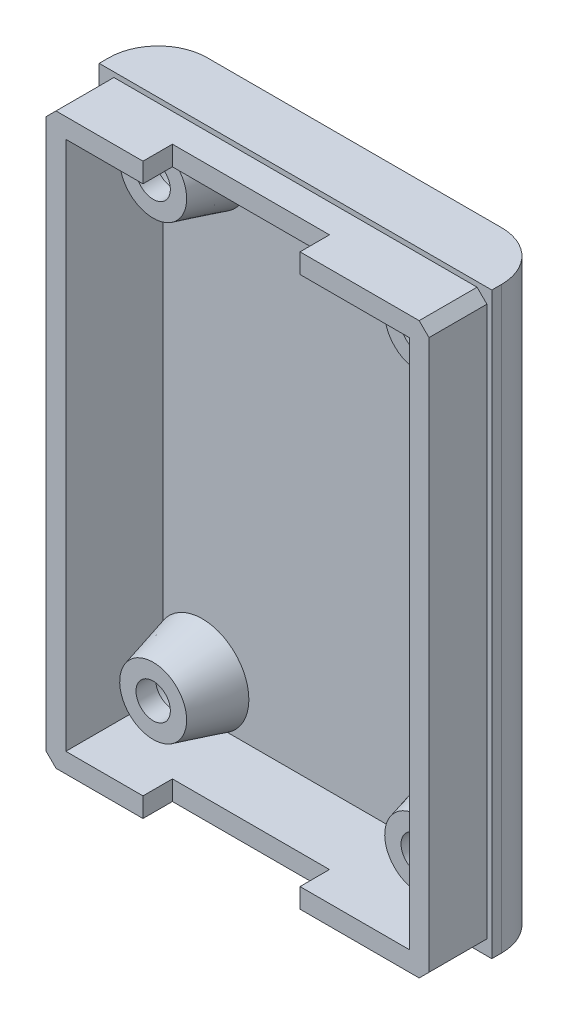
from build123d import *

# Parameters (mm, degrees)
BASE_W              = 40
BASE_H              = 59
EXTRUDE_1_DEPTH     = 2
SKETCH_2_W          = 40
SKETCH_2_H          = 59
SKETCH_2_W_2        = 35
SKETCH_2_H_2        = 54
EXTRUDE_2_DEPTH     = 10
SKETCH_3_R          = 3.25
EXTRUDE_3_DEPTH     = 5
SKETCH_4_R          = 2.9
CUT_EXTRUDE_2_DEPTH = 5
CHAMFER_1_SIZE      = 1.5
CHAMFER_1_SIZE_2    = 5.598076211
SKETCH_6_R          = 1.75
CUT_EXTRUDE_3_DEPTH = 38.896736188
FILLET_1_R          = 5
SKETCH_7_W          = 40
SKETCH_7_H          = 59
SKETCH_7_W_2        = 39
SKETCH_7_H_2        = 58
CUT_EXTRUDE_6_DEPTH = 6
CHAMFER_2_SIZE      = 1
SKETCH_8_W          = 43.293299122
SKETCH_8_H          = 71.249143308
CUT_EXTRUDE_7_DEPTH = 0.1
SKETCH_9_W          = 16
SKETCH_9_H          = 3
CUT_EXTRUDE_8_DEPTH = 64.13297577


with BuildPart() as part:
    # base → Бобышка-Вытянуть1 (new body)
    with BuildSketch(Plane.XY):
        with Locations((-0.540511526, 0)):
            Rectangle(BASE_W, BASE_H)
    extrude(amount=EXTRUDE_1_DEPTH)

    # Эскиз2 → Бобышка-Вытянуть2 (add)
    with BuildSketch(Plane.XY.offset(2)):
        with Locations((-0.540511526, 0)):
            Rectangle(SKETCH_2_W, SKETCH_2_H)
        with Locations((-0.540511526, 0)):
            Rectangle(SKETCH_2_W_2, SKETCH_2_H_2, mode=Mode.SUBTRACT)
    extrude(amount=EXTRUDE_2_DEPTH)

    # Эскиз3 → Бобышка-Вытянуть3 (add)
    with BuildSketch(Plane.XY.offset(2)):
        with Locations((-14.040511526, -23)):
            Circle(SKETCH_3_R)
        with Locations((12.959488474, -23)):
            Circle(SKETCH_3_R)
        with Locations((12.959488474, 23)):
            Circle(SKETCH_3_R)
        with Locations((-14.040511526, 23)):
            Circle(SKETCH_3_R)
    extrude(amount=EXTRUDE_3_DEPTH)

    # Эскиз4 → Вырез-Вытянуть2 (cut)
    with BuildSketch(Plane(origin=(0, 0, 0), x_dir=(-1, 0, 0), z_dir=(0, 0, -1))):
        with Locations((14.040511526, -23)):
            Circle(SKETCH_4_R)
        with Locations((-12.959488474, -23)):
            Circle(SKETCH_4_R)
        with Locations((-12.959488474, 23)):
            Circle(SKETCH_4_R)
        with Locations((14.040511526, 23)):
            Circle(SKETCH_4_R)
    extrude(amount=-CUT_EXTRUDE_2_DEPTH, mode=Mode.SUBTRACT)

    # Фаска1
    # the kernel refuses this chamfer: 5.598076211, 1.5 mm, written as the material it adds along each edge
    with BuildSketch(Plane(origin=(-14.040511526, 23, 2), x_dir=(1, 0, 0), z_dir=(0, -1, 0))) as chamfer_1_piece_1_section:
        Polygon((3.25 + CHAMFER_1_SIZE, 0), (3.25, CHAMFER_1_SIZE_2), (3.25, 0), align=None)
    chamfer_1_piece_1 = revolve(axis=Axis((-14.040511526, 23, 2), (0, 0, 1)), mode=Mode.PRIVATE)
    chamfer_1_piece_1 = split(chamfer_1_piece_1, bisect_by=Plane(origin=(-14.040511526, 23, 7), z_dir=(0, 0, -1)), keep=Keep.TOP, mode=Mode.PRIVATE)
    add(chamfer_1_piece_1)
    with BuildSketch(Plane(origin=(12.959488474, 23, 2), x_dir=(1, 0, 0), z_dir=(0, -1, 0))) as chamfer_1_piece_2_section:
        Polygon((3.25 + CHAMFER_1_SIZE, 0), (3.25, CHAMFER_1_SIZE_2), (3.25, 0), align=None)
    chamfer_1_piece_2 = revolve(axis=Axis((12.959488474, 23, 2), (0, 0, 1)), mode=Mode.PRIVATE)
    chamfer_1_piece_2 = split(chamfer_1_piece_2, bisect_by=Plane(origin=(12.959488474, 23, 7), z_dir=(0, 0, -1)), keep=Keep.TOP, mode=Mode.PRIVATE)
    add(chamfer_1_piece_2)
    with BuildSketch(Plane(origin=(-14.040511526, -23, 2), x_dir=(1, 0, 0), z_dir=(0, -1, 0))) as chamfer_1_piece_3_section:
        Polygon((3.25 + CHAMFER_1_SIZE, 0), (3.25, CHAMFER_1_SIZE_2), (3.25, 0), align=None)
    chamfer_1_piece_3 = revolve(axis=Axis((-14.040511526, -23, 2), (0, 0, 1)), mode=Mode.PRIVATE)
    chamfer_1_piece_3 = split(chamfer_1_piece_3, bisect_by=Plane(origin=(-14.040511526, -23, 7), z_dir=(0, 0, -1)), keep=Keep.TOP, mode=Mode.PRIVATE)
    add(chamfer_1_piece_3)
    with BuildSketch(Plane(origin=(12.959488474, -23, 2), x_dir=(1, 0, 0), z_dir=(0, -1, 0))) as chamfer_1_piece_4_section:
        Polygon((3.25 + CHAMFER_1_SIZE, 0), (3.25, CHAMFER_1_SIZE_2), (3.25, 0), align=None)
    chamfer_1_piece_4 = revolve(axis=Axis((12.959488474, -23, 2), (0, 0, 1)), mode=Mode.PRIVATE)
    chamfer_1_piece_4 = split(chamfer_1_piece_4, bisect_by=Plane(origin=(12.959488474, -23, 7), z_dir=(0, 0, -1)), keep=Keep.TOP, mode=Mode.PRIVATE)
    add(chamfer_1_piece_4)

    # Эскиз6 → Вырез-Вытянуть3 (cut, through all)
    with BuildSketch(Plane(origin=(0, 0, 0), x_dir=(-1, 0, 0), z_dir=(0, 0, -1))):
        with Locations((-12.959488474, 23)):
            Circle(SKETCH_6_R)
        with Locations((14.040511526, 23)):
            Circle(SKETCH_6_R)
        with Locations((14.040511526, -23)):
            Circle(SKETCH_6_R)
        with Locations((-12.959488474, -23)):
            Circle(SKETCH_6_R)
    extrude(amount=-CUT_EXTRUDE_3_DEPTH, mode=Mode.SUBTRACT)

    # Скругление1
    # the kernel refuses this fillet: 5 mm, written as the material it takes off along each edge
    with BuildSketch(Plane(origin=(19.459488474, -42, 0), x_dir=(0, 0, 1), z_dir=(0, 1, 0)), Plane(origin=(-20.540511526, 42, 0), x_dir=(0, 0, 1), z_dir=(0, -1, 0))) as fillet_1_piece_1:
        with BuildLine():
            CenterArc((FILLET_1_R, -FILLET_1_R), FILLET_1_R, 90, 90)
            Line((0, -FILLET_1_R), (0, 0))
            Line((0, 0), (FILLET_1_R, 0))
        make_face()
    extrude(amount=84, mode=Mode.SUBTRACT)

    # Эскиз7 → Вырез-Вытянуть6 (cut)
    with BuildSketch(Plane.XY.offset(12)):
        with Locations((-0.540511526, 0)):
            Rectangle(SKETCH_7_W, SKETCH_7_H)
        with Locations((-0.540511526, 0)):
            Rectangle(SKETCH_7_W_2, SKETCH_7_H_2, mode=Mode.SUBTRACT)
    extrude(amount=-CUT_EXTRUDE_6_DEPTH, mode=Mode.SUBTRACT)

    # Фаска2
    chamfer_2_edges = [part.edges().sort_by_distance(p)[0] for p in [
        (-20.040511526, 29, 9),
        (-20.040511526, -29, 9),
        (18.959488474, -29, 9),
        (18.959488474, 29, 9),
    ]]
    chamfer(chamfer_2_edges, length=CHAMFER_2_SIZE)

    # Эскиз8 → Вырез-Вытянуть7 (cut)
    with BuildSketch(Plane.XY.offset(12)):
        with Locations((-1.042207714, -0.462672782)):
            Rectangle(SKETCH_8_W, SKETCH_8_H)
    extrude(amount=-CUT_EXTRUDE_7_DEPTH, mode=Mode.SUBTRACT)

    # Эскиз9 → Вырез-Вытянуть8 (cut, through all)
    with BuildSketch(Plane(origin=(0, 29, 0), x_dir=(1, 0, 0), z_dir=(0, 1, 0))):
        with Locations((-2.179108085, -10.4)):
            Rectangle(SKETCH_9_W, SKETCH_9_H)
    extrude(amount=-CUT_EXTRUDE_8_DEPTH, mode=Mode.SUBTRACT)


solid = part.part
